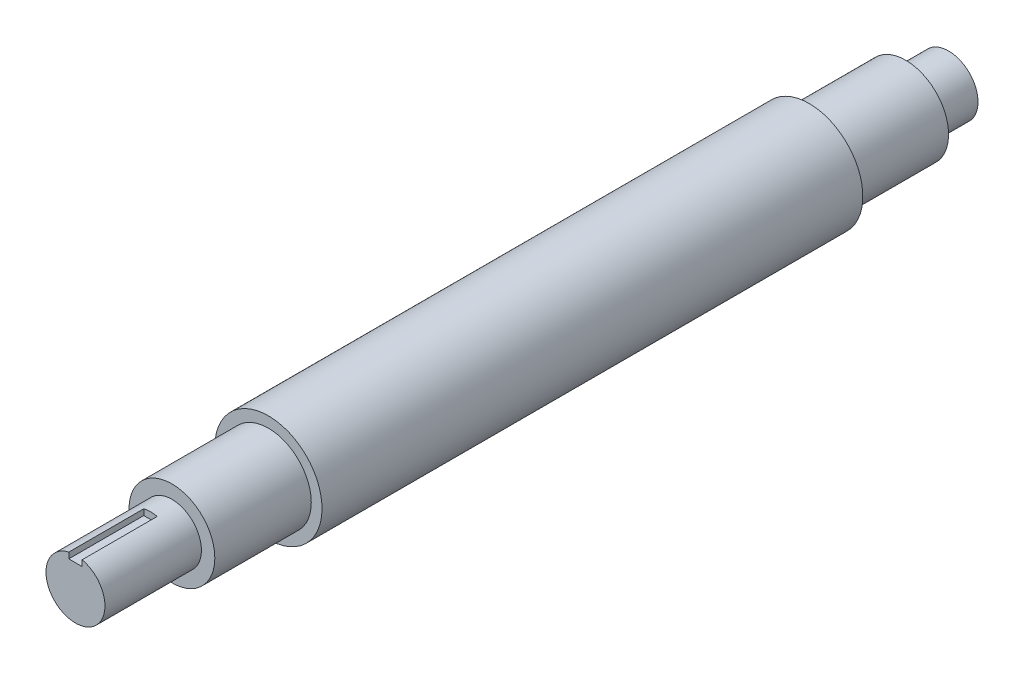
from build123d import *

# Parameters (mm, degrees)
SKETCH1_R           = 31.75
BOSS_EXTRUDE1_DEPTH = 160.1978
SKETCH2_R           = 25.4
BOSS_EXTRUDE2_DEPTH = 57.15
BOSS_EXTRUDE3_START = 57.15
SKETCH3_R           = 25.4
BOSS_EXTRUDE3_DEPTH = 57.15
SKETCH5_R           = 17.4625
BOSS_EXTRUDE5_DEPTH = 25.4
BOSS_EXTRUDE6_START = 57.15
SKETCH18_R          = 17.4625
BOSS_EXTRUDE6_DEPTH = 57.15
SKETCH20_W          = 7.9248
SKETCH20_H          = 7.9248
CUT_EXTRUDE1_DEPTH  = 44.45


with BuildPart() as part:
    # Sketch1 → Boss-Extrude1 (new, symmetric)
    with BuildSketch(Plane.XY):
        Circle(SKETCH1_R)
    extrude(amount=BOSS_EXTRUDE1_DEPTH, both=True)

    # Sketch2 → Boss-Extrude2 (add)
    with BuildSketch(Plane.XY.offset(160.1978)):
        Circle(SKETCH2_R)
    extrude(amount=BOSS_EXTRUDE2_DEPTH)

    # Sketch3 → Boss-Extrude3 (add)
    with BuildSketch(Plane(origin=(0, 0, -160.1978), x_dir=(-1, 0, 0), z_dir=(0, 0, -1)).offset(BOSS_EXTRUDE3_START)):
        Circle(SKETCH3_R)
    extrude(amount=-BOSS_EXTRUDE3_DEPTH)

    # Sketch5 → Boss-Extrude5 (add)
    with BuildSketch(Plane(origin=(0, 0, -217.3478), x_dir=(-1, 0, 0), z_dir=(0, 0, -1))):
        Circle(SKETCH5_R)
    extrude(amount=BOSS_EXTRUDE5_DEPTH)

    # Sketch18 → Boss-Extrude6 (add)
    with BuildSketch(Plane.XY.offset(217.3478).offset(BOSS_EXTRUDE6_START)):
        Circle(SKETCH18_R)
    extrude(amount=-BOSS_EXTRUDE6_DEPTH)

    # Sketch20 → Cut-Extrude1 (cut)
    with BuildSketch(Plane.XY.offset(274.4978)):
        with Locations((0, 17.4625)):
            Rectangle(SKETCH20_W, SKETCH20_H)
    extrude(amount=-CUT_EXTRUDE1_DEPTH, mode=Mode.SUBTRACT)


solid = part.part
